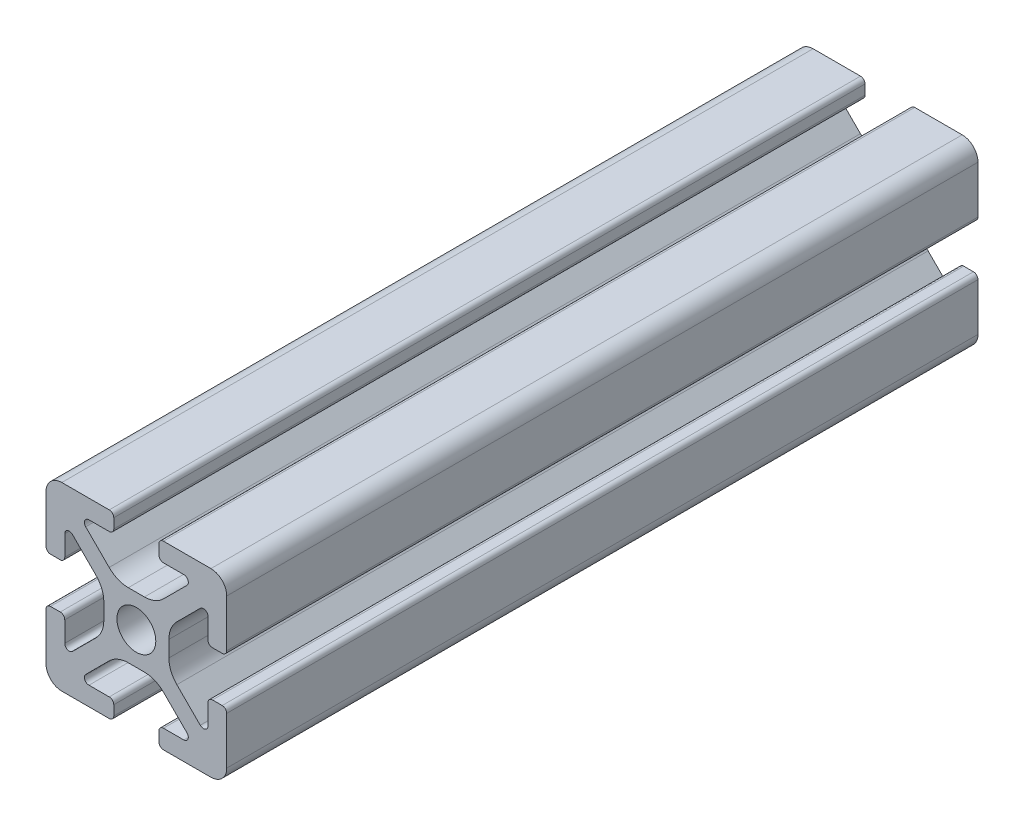
from build123d import *

# Parameters (mm, degrees)
BOSS_EXTRUDE1_DEPTH = 41.57


with BuildPart() as part:
    # Sketch4 → Boss-Extrude1 (new, symmetric)
    with BuildSketch(Plane.XY):
        with BuildLine():
            Line((3, -10), (8.25, -10))
            ThreePointArc((8.25, -10), (9.487436867, -9.487436867), (10, -8.25))
            Line((10, -8.25), (10, -3))
            ThreePointArc((10, -3), (9.853553391, -2.646446609), (9.5, -2.5))
            Line((9.5, -2.5), (8.424621202, -2.5))
            ThreePointArc((8.424621202, -2.5), (8.071067812, -2.646446609), (7.924621202, -3))
            Line((7.924621202, -3), (7.924621202, -5.25))
            ThreePointArc((7.924621202, -5.25), (7.615962919, -5.711939766), (7.071067812, -5.603553391))
            Line((7.071067812, -5.603553391), (4.478679656, -3.011165235))
            ThreePointArc((4.478679656, -3.011165235), (3.828361402, -2.037895189), (3.6, -0.889844892))
            Line((3.6, -0.889844892), (3.6, 0))
            Line((3.6, 0), (2.15, 0))
            ThreePointArc((2.15, 0), (1.52027958, -1.52027958), (0, -2.15))
            Line((0, -2.15), (0, -3.6))
            Line((0, -3.6), (0.889844892, -3.6))
            ThreePointArc((0.889844892, -3.6), (2.037895189, -3.828361402), (3.011165235, -4.478679656))
            Line((3.011165235, -4.478679656), (5.603553391, -7.071067812))
            ThreePointArc((5.603553391, -7.071067812), (5.711939766, -7.615962919), (5.25, -7.924621202))
            Line((5.25, -7.924621202), (3, -7.924621202))
            ThreePointArc((3, -7.924621202), (2.646446609, -8.071067812), (2.5, -8.424621202))
            Line((2.5, -8.424621202), (2.5, -9.5))
            ThreePointArc((2.5, -9.5), (2.646446609, -9.853553391), (3, -10))
        make_face()
    extrude(amount=BOSS_EXTRUDE1_DEPTH, both=True)

    # Mirror1: part across plane


with BuildPart() as part_1:
    add(part.part)
    add(part.part.mirror(Plane(origin=(0, 0, 0), x_dir=(0, 0, 1), z_dir=(1, 0, 0))))

    # Mirror2: part across plane


with BuildPart() as part_2:
    add(part_1.part)
    add(part_1.part.mirror(Plane.ZX))


solid = part_2.part
